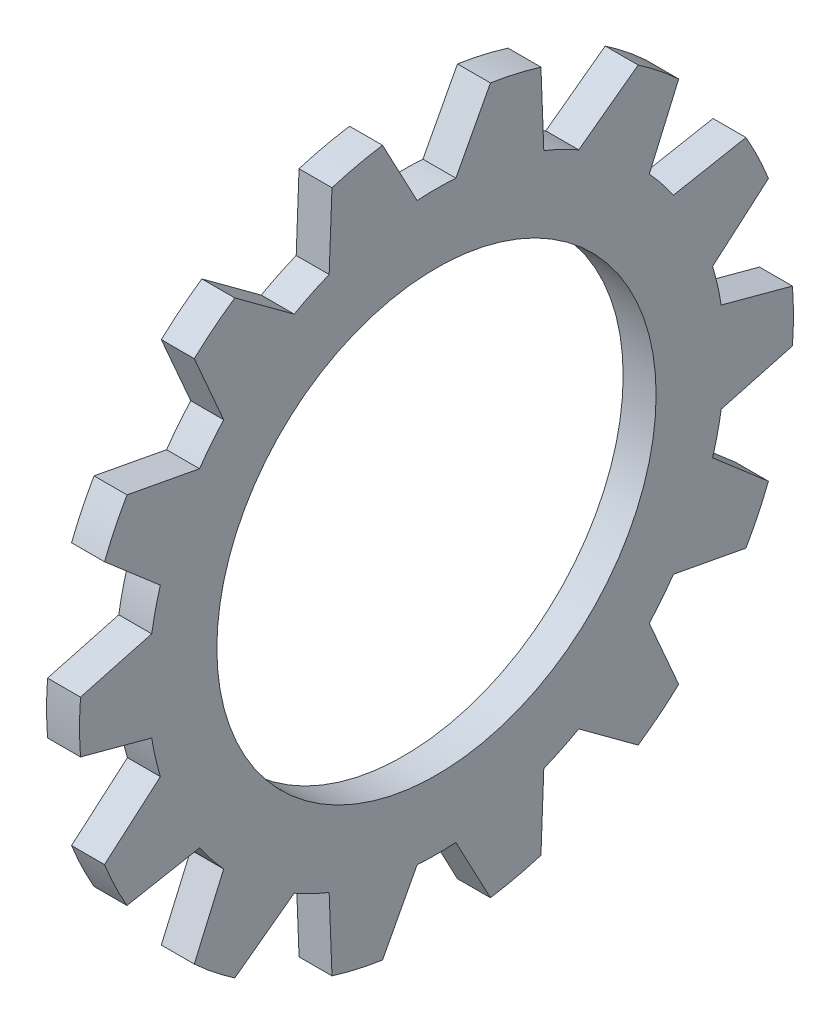
from build123d import *

# Parameters (mm, degrees)
SECSKE_W      = 1.2
SECSKE_H      = 5
EXTCUT_DEPTH  = 19.423897525
EXTCUTS_COUNT = 14
EXTCUTS_ANGLE = 334.285714286


with BuildPart() as part:
    # SecSke → Body (revolve)
    with BuildSketch(Plane.XY):
        with Locations((-0.6, 10.5)):
            Rectangle(SECSKE_W, SECSKE_H)
    revolve(axis=Axis((-34.925, 0, 0), (1, 0, 0)))

    # ExtCutSke → ExtCut (cut, through all)
    with BuildSketch(Plane(origin=(0, 0, 0), x_dir=(0, 0, -1), z_dir=(1, 0, 0))):
        with BuildLine():
            Line((-2.286459948, 13.457139403), (-0.706324559, 10.476216188))
            ThreePointArc((-0.706324559, 10.476216188), (0, 10.5), (0.706324559, 10.476216188))
            Line((0.706324559, 10.476216188), (2.286459948, 13.457139403))
            ThreePointArc((2.286459948, 13.457139403), (0, 13.65), (-2.286459948, 13.457139403))
        make_face()
    extcut = extrude(amount=-EXTCUT_DEPTH, mode=Mode.SUBTRACT)

    # ExtCuts: ExtCut ×14 about axis
    extcuts_axis = Axis((-34.925, 0, 0), (1, 0, 0))
    for i in range(1, EXTCUTS_COUNT):
        add(extcut.rotate(extcuts_axis, i * EXTCUTS_ANGLE / (EXTCUTS_COUNT - 1)), mode=Mode.SUBTRACT)


solid = part.part
